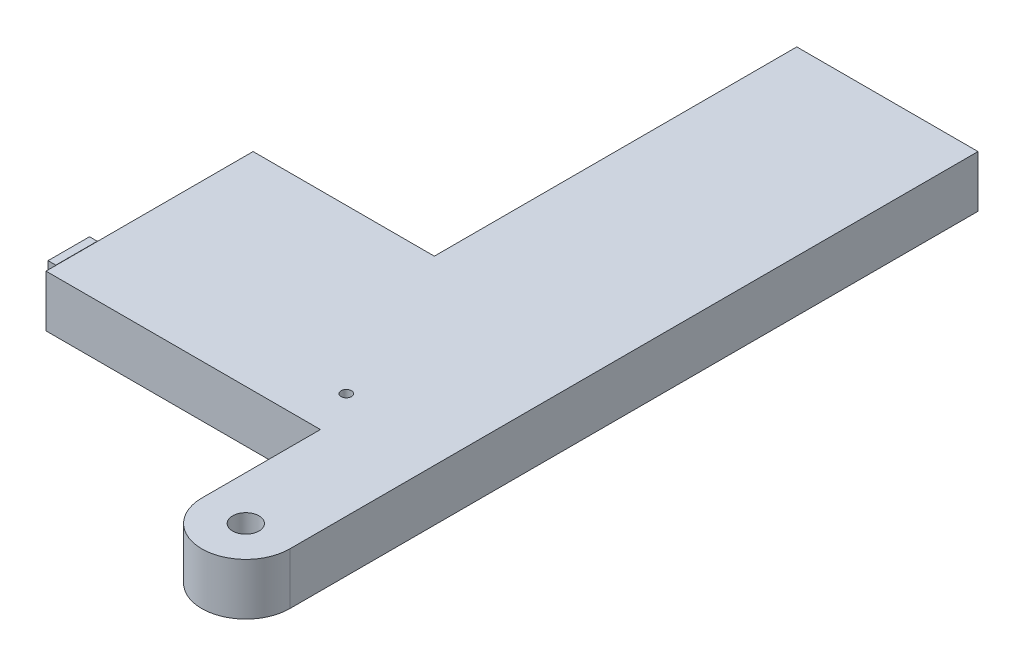
from build123d import *

# Parameters (mm, degrees)
CORNERBOSS_EXTRUDE1_DEPTH               = 20
SHELL1_T                                = -3
PADSKETCH1_R                            = 5
PADSKETCH1_R_2                          = 12
PADBOSS_EXTRUDE1_DEPTH                  = 10
STEPPERSHAFTCUT_SKETCH3_R               = 5.1
STEPPERSHAFTCUT_SKETCH3_R_2             = 2
STEPPERSHAFTCUT_EXTRUDE1_DEPTH          = 262.09193783
THREADEDNUTMOUNTHOLESSKETCH5_R          = 1
THREADEDNUTMOUNTHOLESCUT_EXTRUDE2_DEPTH = 10
TOPPEGHOLESKETCH4_W                     = 10
TOPPEGHOLESKETCH4_H                     = 14
TOPPEGHOLECUT_EXTRUDE2_DEPTH            = 3
BLPEGSKETCH5_W                          = 9.8
BLPEGSKETCH5_H                          = 13.9
BLPEGBOSS_EXTRUDE3_DEPTH                = 3.1
BLPEGCAPSKETCH6_W                       = 16
BLPEGCAPSKETCH6_H                       = 17
BLPEGCAPBOSS_EXTRUDE4_DEPTH             = 3
BEDCENTERPEGHOLECUTSKETCH1_W            = 10
BEDCENTERPEGHOLECUTSKETCH1_H            = 14
BEDCENTERPEGHOLECUT_EXTRUDE1_DEPTH      = 3


with BuildPart() as part:
    # CornerrSketch1 → CornerBoss-Extrude1 (new body)
    with BuildSketch(Plane(origin=(0, 0, 0), x_dir=(1, 0, 0), z_dir=(0, 1, 0))):
        with BuildLine():
            Line((0, 0), (0, 80))
            Line((0, 80), (70, 80))
            Line((70, 80), (70, 220))
            Line((70, 220), (140, 220))
            Line((140, 220), (140, -45.825))
            ThreePointArc((140, -45.825), (123, -62.825), (106, -45.825))
            Line((106, -45.825), (106, 0))
            Line((106, 0), (0, 0))
        make_face()
    extrude(amount=CORNERBOSS_EXTRUDE1_DEPTH)

    # Shell1
    shell1_openings = [part.faces().sort_by_distance(p)[0] for p in [
        (89.539211683, 0, -80.750143578),
    ]]
    offset(amount=SHELL1_T, openings=shell1_openings, kind=Kind.INTERSECTION)

    # PadSketch1 → PadBoss-Extrude1 (add)
    with BuildSketch(Plane.XZ.offset(-17)):
        with Locations((99, -17)):
            Circle(PADSKETCH1_R)
        with Locations((123, 45.825)):
            Circle(PADSKETCH1_R_2)
    extrude(amount=PADBOSS_EXTRUDE1_DEPTH)

    # StepperShaftCut-Sketch3 → StepperShaftCut-Extrude1 (cut, through all)
    with BuildSketch(Plane.XZ.offset(-7)):
        with Locations((123, 45.825)):
            Circle(STEPPERSHAFTCUT_SKETCH3_R)
        with Locations((99, -17)):
            Circle(STEPPERSHAFTCUT_SKETCH3_R_2)
    extrude(amount=-STEPPERSHAFTCUT_EXTRUDE1_DEPTH, mode=Mode.SUBTRACT)

    # ThreadedNutMountHolesSketch5 → ThreadedNutMountHolesCut-Extrude2 (cut)
    with BuildSketch(Plane.XZ.offset(-7)):
        with Locations((123, 53.825)):
            Circle(THREADEDNUTMOUNTHOLESSKETCH5_R)
        with Locations((131, 45.825)):
            Circle(THREADEDNUTMOUNTHOLESSKETCH5_R)
        with Locations((115, 45.825)):
            Circle(THREADEDNUTMOUNTHOLESSKETCH5_R)
        with Locations((123, 37.825)):
            Circle(THREADEDNUTMOUNTHOLESSKETCH5_R)
    extrude(amount=-THREADEDNUTMOUNTHOLESCUT_EXTRUDE2_DEPTH, mode=Mode.SUBTRACT)

    # TopPegHoleSketch4 → TopPegHoleCut-Extrude2 (cut)
    with BuildSketch(Plane(origin=(0, 0, -220), x_dir=(-1, 0, 0), z_dir=(0, 0, -1))):
        with Locations((-125, 7)):
            Rectangle(TOPPEGHOLESKETCH4_W, TOPPEGHOLESKETCH4_H)
    extrude(amount=-TOPPEGHOLECUT_EXTRUDE2_DEPTH, mode=Mode.SUBTRACT)

    # BLPegSketch5 → BLPegBoss-Extrude3 (add)
    with BuildSketch(Plane.ZY):
        with Locations((-15, 6.95)):
            Rectangle(BLPEGSKETCH5_W, BLPEGSKETCH5_H)
    extrude(amount=BLPEGBOSS_EXTRUDE3_DEPTH)

    # BLPegCapSketch6 → BLPegCapBoss-Extrude4 (add)
    with BuildSketch(Plane.ZY.offset(3.1)):
        with Locations((-14.9, 8.5)):
            Rectangle(BLPEGCAPSKETCH6_W, BLPEGCAPSKETCH6_H)
    extrude(amount=BLPEGCAPBOSS_EXTRUDE4_DEPTH)

    # BedCenterPegHoleCutSketch1 → BedCenterPegHoleCut-Extrude1 (cut)
    with BuildSketch(Plane.ZY.offset(-70)):
        with Locations((-185, 7)):
            Rectangle(BEDCENTERPEGHOLECUTSKETCH1_W, BEDCENTERPEGHOLECUTSKETCH1_H)
    extrude(amount=-BEDCENTERPEGHOLECUT_EXTRUDE1_DEPTH, mode=Mode.SUBTRACT)


solid = part.part
